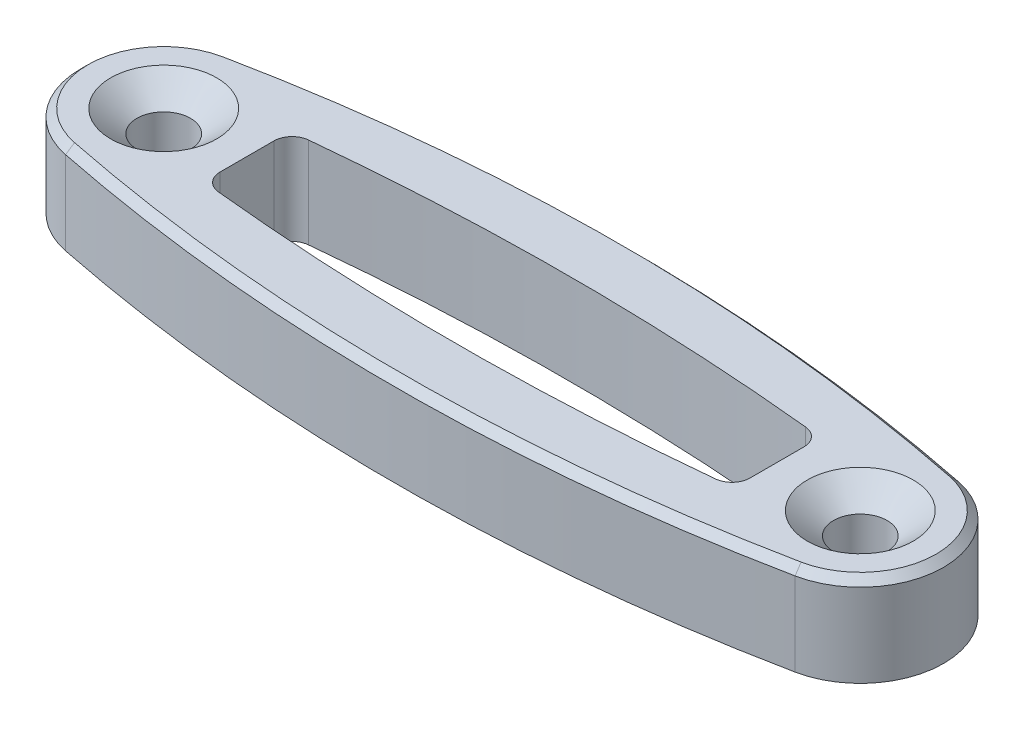
from build123d import *

# Parameters (mm, degrees)
BOSS_EXTRUDE1_DEPTH                               = 7.62
CSK_FOR_8_FLAT_HEAD_MACHINE_SCREW_100_D           = 4.4958
CSK_FOR_8_FLAT_HEAD_MACHINE_SCREW_100_CSINK_D     = 8.89
CSK_FOR_8_FLAT_HEAD_MACHINE_SCREW_100_CSINK_ANGLE = 100
CHAMFER1_SIZE                                     = 0.635


with BuildPart() as part:
    # Sketch1 → Boss-Extrude1 (new body)
    with BuildSketch(Plane(origin=(0, 0, 0), x_dir=(1, 0, 0), z_dir=(0, 1, 0))):
        with BuildLine():
            Line((22.225, 2.258558918), (22.225, -2.258558918))
            ThreePointArc((22.225, -2.258558918), (21.831513849, -3.28057381), (20.854246144, -3.774834493))
            ThreePointArc((20.854246144, -3.774834493), (10.44036076, -4.563041917), (0, -4.826))
            Line((0, -4.826), (0, -9.906))
            ThreePointArc((0, -9.906), (15.372876822, -9.13926822), (30.593168317, -6.846683168))
            ThreePointArc((30.593168317, -6.846683168), (36.195, 0), (30.593168317, 6.846683168))
            ThreePointArc((30.593168317, 6.846683168), (15.372876822, 9.13926822), (0, 9.906))
            Line((0, 9.906), (0, 4.826))
            ThreePointArc((0, 4.826), (10.44036076, 4.563041917), (20.854246144, 3.774834493))
            ThreePointArc((20.854246144, 3.774834493), (21.831513849, 3.28057381), (22.225, 2.258558918))
        make_face()
    extrude(amount=BOSS_EXTRUDE1_DEPTH)

    # CSK for #8 Flat Head Machine Screw (100)1 (through all)
    with Locations(Plane(origin=(0, 7.62, 0), x_dir=(1, 0, 0), z_dir=(0, 1, 0))):
        with Locations((29.21, 0)):
            CounterSinkHole(CSK_FOR_8_FLAT_HEAD_MACHINE_SCREW_100_D / 2, CSK_FOR_8_FLAT_HEAD_MACHINE_SCREW_100_CSINK_D / 2, counter_sink_angle=CSK_FOR_8_FLAT_HEAD_MACHINE_SCREW_100_CSINK_ANGLE)

    # Mirror1: part across plane


with BuildPart() as part_1:
    add(part.part)
    add(part.part.mirror(Plane(origin=(0, 0, 0), x_dir=(0, 0, 1), z_dir=(1, 0, 0))))

    # Chamfer1
    chamfer1_edges = [part_1.edges().sort_by_distance(p)[0] for p in [
        (0, 7.62, -9.906),
        (-36.195, 7.62, 0),
        (36.195, 7.62, 0),
        (0, 7.62, 9.906),
    ]]
    chamfer(chamfer1_edges, length=CHAMFER1_SIZE)


solid = part_1.part
